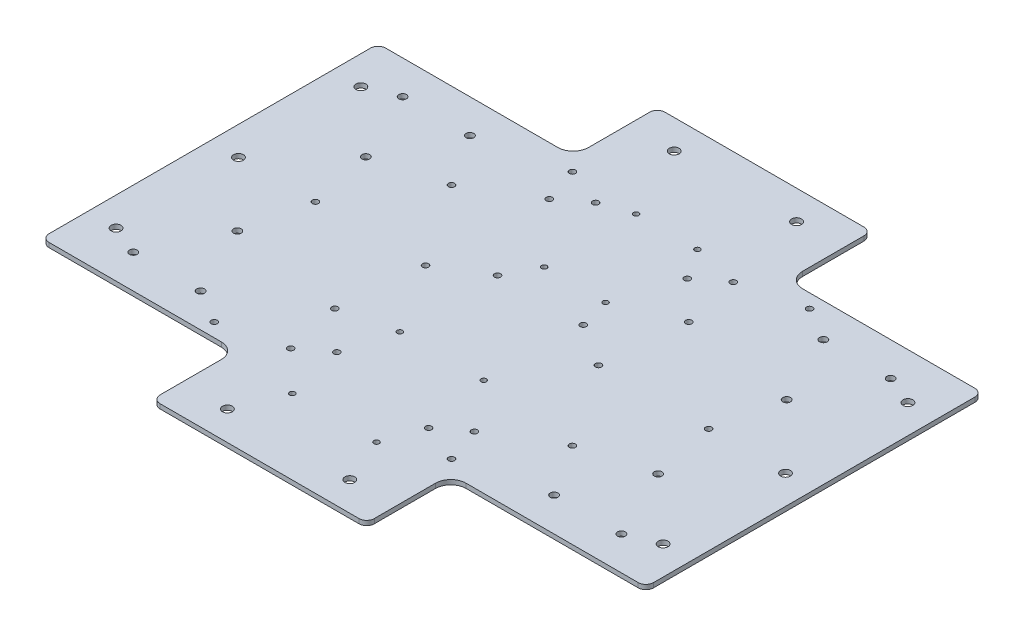
from build123d import *

# Parameters (mm, degrees)
SKETCH_1_R          = 2.5
SKETCH_1_R_2        = 3.2
EXTRUDE_1_DEPTH     = 3
SKETCH_2_R          = 2
SKETCH_2_R_2        = 1.75
CUT_EXTRUDE_1_DEPTH = 10


with BuildPart() as part:
    # Эскиз1 → Бобышка-Вытянуть1 (new body)
    with BuildSketch(Plane(origin=(0, 0, 0), x_dir=(1, 0, 0), z_dir=(0, 1, 0))):
        with BuildLine():
            ThreePointArc((-70, -160), (-68.535533906, -163.535533906), (-65, -165))
            Line((-65, -165), (65, -165))
            ThreePointArc((65, -165), (68.535533906, -163.535533906), (70, -160))
            Line((70, -160), (70, -120))
            ThreePointArc((70, -120), (72.928932188, -112.928932188), (80, -110))
            Line((80, -110), (134.901841239, -110))
            Line((134.901841239, -110), (160.901841239, -110))
            Line((160.901841239, -110), (192.5, -110))
            ThreePointArc((192.5, -110), (196.035533906, -108.535533906), (197.5, -105))
            Line((197.5, -105), (197.5, 105))
            ThreePointArc((197.5, 105), (196.035533906, 108.535533906), (192.5, 110))
            Line((192.5, 110), (160.901841239, 110))
            Line((160.901841239, 110), (134.901841239, 110))
            Line((134.901841239, 110), (80, 110))
            ThreePointArc((80, 110), (72.928932188, 112.928932188), (70, 120))
            Line((70, 120), (70, 160))
            ThreePointArc((70, 160), (68.535533906, 163.535533906), (65, 165))
            Line((65, 165), (-65, 165))
            ThreePointArc((-65, 165), (-68.535533906, 163.535533906), (-70, 160))
            Line((-70, 160), (-70, 120))
            ThreePointArc((-70, 120), (-72.928932188, 112.928932188), (-80, 110))
            Line((-80, 110), (-134.901841239, 110))
            Line((-134.901841239, 110), (-160.901841239, 110))
            Line((-160.901841239, 110), (-192.5, 110))
            ThreePointArc((-192.5, 110), (-196.035533906, 108.535533906), (-197.5, 105))
            Line((-197.5, 105), (-197.5, -105))
            ThreePointArc((-197.5, -105), (-196.035533906, -108.535533906), (-192.5, -110))
            Line((-192.5, -110), (-80, -110))
            ThreePointArc((-80, -110), (-72.928932188, -112.928932188), (-70, -120))
            Line((-70, -120), (-70, -160))
        make_face()
        with Locations((-159.5, -88)):
            Circle(SKETCH_1_R, mode=Mode.SUBTRACT)
        with Locations((-115.5, -88)):
            Circle(SKETCH_1_R, mode=Mode.SUBTRACT)
        with Locations((-40, -146)):
            Circle(SKETCH_1_R_2, mode=Mode.SUBTRACT)
        with Locations((-178.768667216, -80)):
            Circle(SKETCH_1_R_2, mode=Mode.SUBTRACT)
        with Locations((-137.5, -42)):
            Circle(SKETCH_1_R, mode=Mode.SUBTRACT)
        with Locations((40, -146)):
            Circle(SKETCH_1_R_2, mode=Mode.SUBTRACT)
        with Locations((115.5, -88)):
            Circle(SKETCH_1_R, mode=Mode.SUBTRACT)
        with Locations((159.5, -88)):
            Circle(SKETCH_1_R, mode=Mode.SUBTRACT)
        with Locations((137.5, -42)):
            Circle(SKETCH_1_R, mode=Mode.SUBTRACT)
        with Locations((178.768667216, -80)):
            Circle(SKETCH_1_R_2, mode=Mode.SUBTRACT)
        with Locations((-178.768667216, 0)):
            Circle(SKETCH_1_R_2, mode=Mode.SUBTRACT)
        with Locations((-178.768667216, 80)):
            Circle(SKETCH_1_R_2, mode=Mode.SUBTRACT)
        with Locations((-137.5, 42)):
            Circle(SKETCH_1_R, mode=Mode.SUBTRACT)
        with Locations((-159.5, 88)):
            Circle(SKETCH_1_R, mode=Mode.SUBTRACT)
        with Locations((-115.5, 88)):
            Circle(SKETCH_1_R, mode=Mode.SUBTRACT)
        with Locations((-40, 146)):
            Circle(SKETCH_1_R_2, mode=Mode.SUBTRACT)
        with Locations((178.768667216, 0)):
            Circle(SKETCH_1_R_2, mode=Mode.SUBTRACT)
        with Locations((137.5, 42)):
            Circle(SKETCH_1_R, mode=Mode.SUBTRACT)
        with Locations((178.768667216, 80)):
            Circle(SKETCH_1_R_2, mode=Mode.SUBTRACT)
        with Locations((40, 146)):
            Circle(SKETCH_1_R_2, mode=Mode.SUBTRACT)
        with Locations((115.5, 88)):
            Circle(SKETCH_1_R, mode=Mode.SUBTRACT)
        with Locations((159.5, 88)):
            Circle(SKETCH_1_R, mode=Mode.SUBTRACT)
    extrude(amount=EXTRUDE_1_DEPTH)

    # Эскиз2 → Вырез-Вытянуть1 (cut)
    with BuildSketch(Plane(origin=(0, 3, 0), x_dir=(1, 0, 0), z_dir=(0, 1, 0))):
        with Locations((128.5, 0)):
            Circle(SKETCH_2_R)
        with Locations((56.5, 0)):
            Circle(SKETCH_2_R)
        with Locations((93.5, 101)):
            Circle(SKETCH_2_R)
        with Locations((61.5, 54)):
            Circle(SKETCH_2_R)
        with Locations((53.5, 91.092247848)):
            Circle(SKETCH_2_R)
        with Locations((36.502982491, 78.046799413)):
            Circle(SKETCH_2_R)
        with Locations((28.680928288, 17.871923503)):
            Circle(SKETCH_2_R)
        with Locations((-27.319071712, 17.871923503)):
            Circle(SKETCH_2_R)
        with Locations((27.496289721, -46.022287392)):
            Circle(SKETCH_2_R_2)
        with Locations((93.5, -54.053341302)):
            Circle(SKETCH_2_R)
        with Locations((61.5, -101.042998556)):
            Circle(SKETCH_2_R)
        with Locations((53.5, -78.07249598)):
            Circle(SKETCH_2_R)
        with Locations((36.502982491, -90.999139468)):
            Circle(SKETCH_2_R)
        with Locations((27.496289721, -116.033195429)):
            Circle(SKETCH_2_R_2)
        with Locations((-27.552622159, -116.033195429)):
            Circle(SKETCH_2_R_2)
        with Locations((-27.319071712, -46)):
            Circle(SKETCH_2_R_2)
        with Locations((-53.636340651, -90.999139468)):
            Circle(SKETCH_2_R)
        with Locations((-36.401722668, -78.07249598)):
            Circle(SKETCH_2_R)
        with Locations((-93.526794479, -101.042998556)):
            Circle(SKETCH_2_R)
        with Locations((-61.727710595, -54.053341302)):
            Circle(SKETCH_2_R)
        with Locations((-36.401722668, 91.092247848)):
            Circle(SKETCH_2_R)
        with Locations((-53.636340651, 78.046799413)):
            Circle(SKETCH_2_R)
        with Locations((-61.541675198, 101)):
            Circle(SKETCH_2_R)
        with Locations((-93.526794479, 54)):
            Circle(SKETCH_2_R)
        with Locations((-128.5, 0)):
            Circle(SKETCH_2_R)
        with Locations((-56.5, 0)):
            Circle(SKETCH_2_R)
        with Locations((-16.832308482, 37.872518528)):
            Circle(SKETCH_2_R_2)
        with Locations((-16.797794126, 97.927570988)):
            Circle(SKETCH_2_R_2)
        with Locations((23.276008527, 97.927570988)):
            Circle(SKETCH_2_R_2)
        with Locations((23.276008527, 37.872518528)):
            Circle(SKETCH_2_R_2)
    extrude(amount=-CUT_EXTRUDE_1_DEPTH, mode=Mode.SUBTRACT)


solid = part.part
